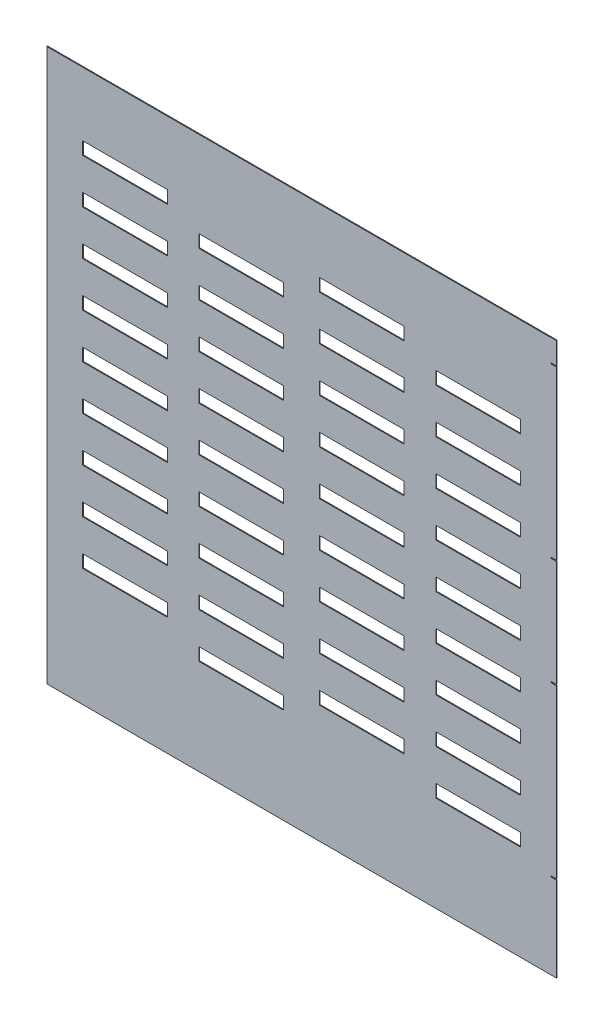
from build123d import *

# Parameters (mm, degrees)
SKETCH1_W          = 1200
SKETCH1_H          = 1300
SKETCH1_W_2        = 200
SKETCH1_H_2        = 30
BASE_FLANGE1_DEPTH = 2
SKETCH2_W          = 2
SKETCH2_H          = 2.5
CUT_EXTRUDE1_DEPTH = 13
FILLET1_R          = 0.74


# Sheet-metal steps are written as plain solids
with BuildPart() as part:
    # Sketch1 → Base-Flange1 (new body)
    with BuildSketch(Plane.XY):
        with Locations((0, -650)):
            Rectangle(SKETCH1_W, SKETCH1_H)
        with Locations((141.733467798, -165)):
            Rectangle(SKETCH1_W_2, SKETCH1_H_2, mode=Mode.SUBTRACT)
        with Locations((-416.206642884, -165)):
            Rectangle(SKETCH1_W_2, SKETCH1_H_2, mode=Mode.SUBTRACT)
        with Locations((141.733467798, -270.294117647)):
            Rectangle(SKETCH1_W_2, SKETCH1_H_2, mode=Mode.SUBTRACT)
        with Locations((141.733467798, -375.588235294)):
            Rectangle(SKETCH1_W_2, SKETCH1_H_2, mode=Mode.SUBTRACT)
        with Locations((141.733467798, -480.882352941)):
            Rectangle(SKETCH1_W_2, SKETCH1_H_2, mode=Mode.SUBTRACT)
        with Locations((141.733467798, -586.176470588)):
            Rectangle(SKETCH1_W_2, SKETCH1_H_2, mode=Mode.SUBTRACT)
        with Locations((141.733467798, -691.470588235)):
            Rectangle(SKETCH1_W_2, SKETCH1_H_2, mode=Mode.SUBTRACT)
        with Locations((141.733467798, -796.764705882)):
            Rectangle(SKETCH1_W_2, SKETCH1_H_2, mode=Mode.SUBTRACT)
        with Locations((141.733467798, -902.058823529)):
            Rectangle(SKETCH1_W_2, SKETCH1_H_2, mode=Mode.SUBTRACT)
        with Locations((141.733467798, -1007.352941176)):
            Rectangle(SKETCH1_W_2, SKETCH1_H_2, mode=Mode.SUBTRACT)
        with Locations((-416.206642884, -270.294117647)):
            Rectangle(SKETCH1_W_2, SKETCH1_H_2, mode=Mode.SUBTRACT)
        with Locations((-416.206642884, -375.588235294)):
            Rectangle(SKETCH1_W_2, SKETCH1_H_2, mode=Mode.SUBTRACT)
        with Locations((-416.206642884, -480.882352941)):
            Rectangle(SKETCH1_W_2, SKETCH1_H_2, mode=Mode.SUBTRACT)
        with Locations((-416.206642884, -586.176470588)):
            Rectangle(SKETCH1_W_2, SKETCH1_H_2, mode=Mode.SUBTRACT)
        with Locations((-416.206642884, -691.470588235)):
            Rectangle(SKETCH1_W_2, SKETCH1_H_2, mode=Mode.SUBTRACT)
        with Locations((-416.206642884, -796.764705882)):
            Rectangle(SKETCH1_W_2, SKETCH1_H_2, mode=Mode.SUBTRACT)
        with Locations((-416.206642884, -902.058823529)):
            Rectangle(SKETCH1_W_2, SKETCH1_H_2, mode=Mode.SUBTRACT)
        with Locations((-416.206642884, -1007.352941176)):
            Rectangle(SKETCH1_W_2, SKETCH1_H_2, mode=Mode.SUBTRACT)
        with Locations((-142.059889318, -217.647058824)):
            Rectangle(SKETCH1_W_2, SKETCH1_H_2, mode=Mode.SUBTRACT)
        with Locations((416.206642884, -217.647058824)):
            Rectangle(SKETCH1_W_2, SKETCH1_H_2, mode=Mode.SUBTRACT)
        with Locations((416.206642884, -322.941176471)):
            Rectangle(SKETCH1_W_2, SKETCH1_H_2, mode=Mode.SUBTRACT)
        with Locations((416.206642884, -428.235294118)):
            Rectangle(SKETCH1_W_2, SKETCH1_H_2, mode=Mode.SUBTRACT)
        with Locations((416.206642884, -533.529411765)):
            Rectangle(SKETCH1_W_2, SKETCH1_H_2, mode=Mode.SUBTRACT)
        with Locations((416.206642884, -638.823529412)):
            Rectangle(SKETCH1_W_2, SKETCH1_H_2, mode=Mode.SUBTRACT)
        with Locations((416.206642884, -744.117647059)):
            Rectangle(SKETCH1_W_2, SKETCH1_H_2, mode=Mode.SUBTRACT)
        with Locations((416.206642884, -849.411764706)):
            Rectangle(SKETCH1_W_2, SKETCH1_H_2, mode=Mode.SUBTRACT)
        with Locations((416.206642884, -954.705882353)):
            Rectangle(SKETCH1_W_2, SKETCH1_H_2, mode=Mode.SUBTRACT)
        with Locations((416.206642884, -1060)):
            Rectangle(SKETCH1_W_2, SKETCH1_H_2, mode=Mode.SUBTRACT)
        with Locations((-142.059889318, -322.941176471)):
            Rectangle(SKETCH1_W_2, SKETCH1_H_2, mode=Mode.SUBTRACT)
        with Locations((-142.059889318, -428.235294118)):
            Rectangle(SKETCH1_W_2, SKETCH1_H_2, mode=Mode.SUBTRACT)
        with Locations((-142.059889318, -533.529411765)):
            Rectangle(SKETCH1_W_2, SKETCH1_H_2, mode=Mode.SUBTRACT)
        with Locations((-142.059889318, -638.823529412)):
            Rectangle(SKETCH1_W_2, SKETCH1_H_2, mode=Mode.SUBTRACT)
        with Locations((-142.059889318, -744.117647059)):
            Rectangle(SKETCH1_W_2, SKETCH1_H_2, mode=Mode.SUBTRACT)
        with Locations((-142.059889318, -849.411764706)):
            Rectangle(SKETCH1_W_2, SKETCH1_H_2, mode=Mode.SUBTRACT)
        with Locations((-142.059889318, -954.705882353)):
            Rectangle(SKETCH1_W_2, SKETCH1_H_2, mode=Mode.SUBTRACT)
        with Locations((-142.059889318, -1060)):
            Rectangle(SKETCH1_W_2, SKETCH1_H_2, mode=Mode.SUBTRACT)
    extrude(amount=-BASE_FLANGE1_DEPTH)

    # Sketch2 → Cut-Extrude1 (cut)
    with BuildSketch(Plane(origin=(600, 0, 0), x_dir=(0, 0, -1), z_dir=(1, 0, 0))):
        with Locations((1, -52.421559212)):
            Rectangle(SKETCH2_W, SKETCH2_H)
        with Locations((1, -449.025123838)):
            Rectangle(SKETCH2_W, SKETCH2_H)
        with Locations((1, -702.479715689)):
            Rectangle(SKETCH2_W, SKETCH2_H)
        with Locations((1, -1099.011436844)):
            Rectangle(SKETCH2_W, SKETCH2_H)
    extrude(amount=-CUT_EXTRUDE1_DEPTH, mode=Mode.SUBTRACT)

    # Fillet1
    fillet1_edges = [part.edges().sort_by_distance(p)[0] for p in [
        (600, -51.171559212, -1),
        (600, -450.275123838, -1),
        (600, -701.229715689, -1),
        (600, -1100.261436844, -1),
    ]]
    fillet(fillet1_edges, radius=FILLET1_R)


solid = part.part
